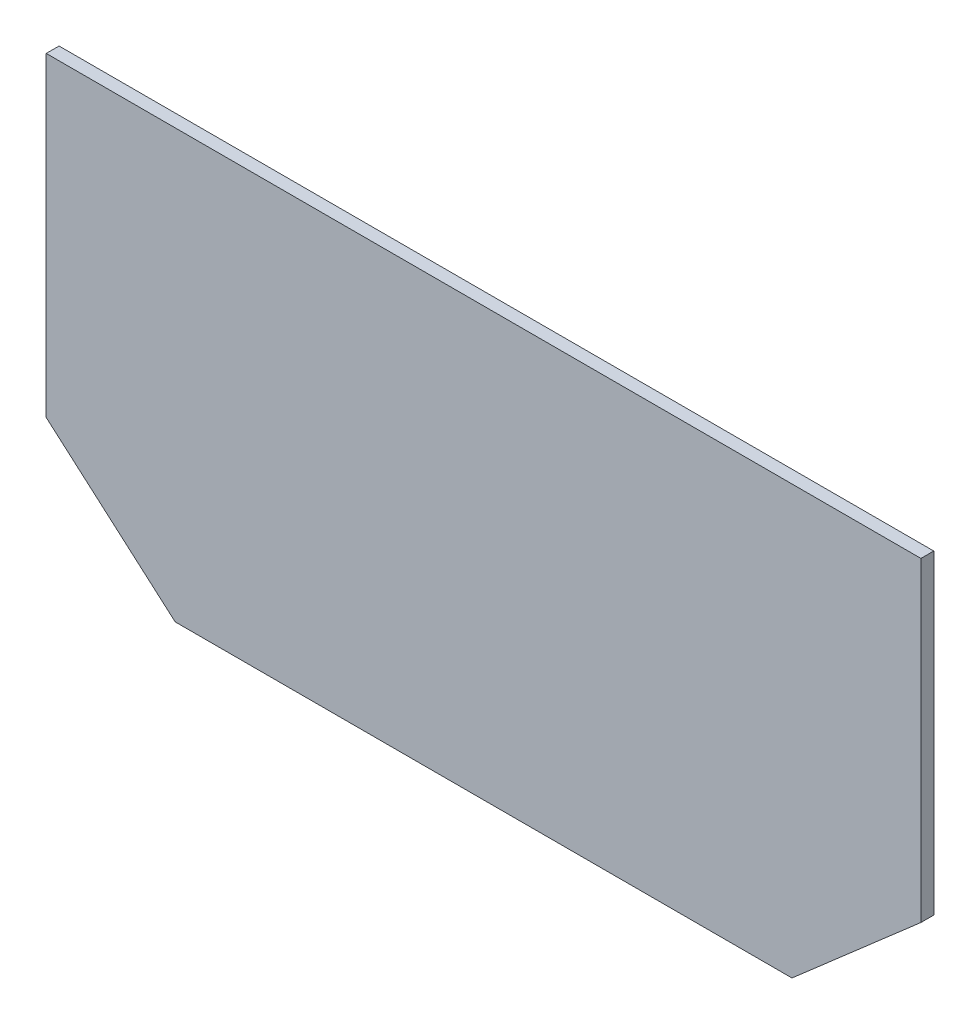
from build123d import *

# Parameters (mm, degrees)
SM_BASE_FLANGE_1_DEPTH = 6


# Sheet-metal steps are written as plain solids
with BuildPart() as part:
    # Sketch 1 → Базовая кромка1 (new body)
    with BuildSketch(Plane.XY):
        Polygon((-204.43774199, -50), (204.43774199, -50), (204.43774199, -197.402134184), (144.15951614, -250), (-144.15951614, -250), (-204.43774199, -197.402134184), align=None)
    extrude(amount=SM_BASE_FLANGE_1_DEPTH)


solid = part.part
